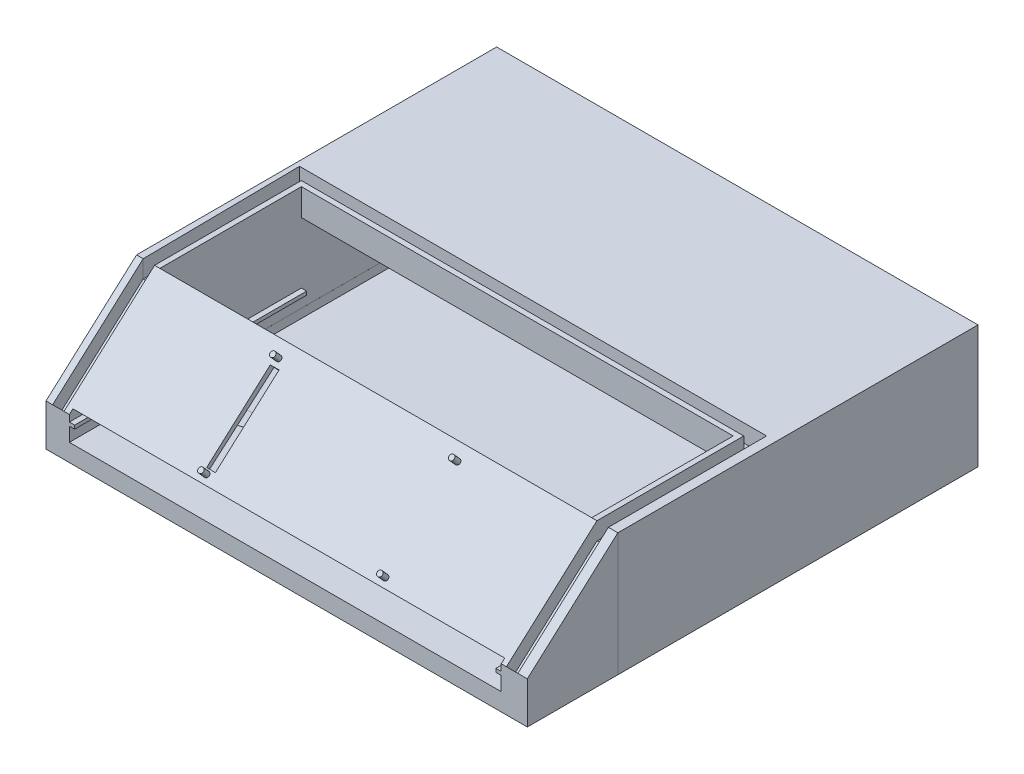
from build123d import *

# Parameters (mm, degrees)
BOSS_EXTRUDE1_DEPTH = 70
CUT_EXTRUDE1_DEPTH  = 10
SKETCH5_W           = 245.829798574
SKETCH5_H           = 84.902413675
CUT_EXTRUDE2_DEPTH  = 60
SKETCH6_R           = 11.15
CUT_EXTRUDE3_DEPTH  = 4.66
CUT_EXTRUDE4_DEPTH  = 5
SKETCH9_W           = 3
SKETCH9_H           = 2
BOSS_EXTRUDE3_DEPTH = 85
SKETCH11_W          = 245.829798574
SKETCH11_H          = 44.743760381
CUT_EXTRUDE6_DEPTH  = 109
BOSS_EXTRUDE5_DEPTH = 274
SKETCH20_W          = 6.5
SKETCH20_H          = 69.236704604
CUT_EXTRUDE7_DEPTH  = 7.45
CUT_EXTRUDE9_DEPTH  = 346.159891301
SKETCH23_W          = 6.5
SKETCH23_H          = 69.236704604
CUT_EXTRUDE10_DEPTH = 7.45
CUT_EXTRUDE11_START = -5.5
CUT_EXTRUDE11_DEPTH = 243
CUT_EXTRUDE12_DEPTH = 5
CUT_EXTRUDE13_DEPTH = 5
SKETCH32_R          = 1.5
BOSS_EXTRUDE7_DEPTH = 5
SKETCH35_W          = 5.00069672
SKETCH35_H          = 48.700830397
CUT_EXTRUDE14_DEPTH = 10
SKETCH38_R          = 1.575
BOSS_EXTRUDE8_DEPTH = 18


with BuildPart() as part:
    # Sketch1 → Boss-Extrude1 (new body)
    with BuildSketch(Plane(origin=(0, 0, 0), x_dir=(1, 0, 0), z_dir=(0, 1, 0))):
        Polygon((263, -90), (0, -90), (-5.297672508, -90), (-5.297672508, 115), (268.719836564, 115), (268.719836564, 109.817232955), (268.719836564, 5.622236561), (268.719836564, -90), align=None)
    extrude(amount=BOSS_EXTRUDE1_DEPTH)

    # Sketch4 → Cut-Extrude1 (cut)
    with BuildSketch(Plane(origin=(0, 70, 0), x_dir=(1, 0, 0), z_dir=(0, 1, 0))):
        Polygon((-1.518607935, -90.000001141), (4.981392065, -90), (4.981392065, -6.438755439), (256.811190639, -6.438755439), (256.811190639, -90), (263.311190639, -90), (263.311190639, 0.061244561), (-2.567831993, 0.061244561), align=None)
    extrude(amount=-CUT_EXTRUDE1_DEPTH, mode=Mode.SUBTRACT)

    # Sketch5 → Cut-Extrude2 (cut)
    with BuildSketch(Plane(origin=(0, 70, 0), x_dir=(1, 0, 0), z_dir=(0, 1, 0))):
        with Locations((130.896291352, -51.889962277)):
            Rectangle(SKETCH5_W, SKETCH5_H)
    extrude(amount=-CUT_EXTRUDE2_DEPTH, mode=Mode.SUBTRACT)

    # Sketch6 → Cut-Extrude3 (cut)
    with BuildSketch(Plane(origin=(0, 10, 0), x_dir=(1, 0, 0), z_dir=(0, 1, 0))):
        with Locations((131.857766281, -74.522104322)):
            Circle(SKETCH6_R)
        with Locations((45.409631344, -74.22492571)):
            Circle(SKETCH6_R)
        with Locations((217.983549657, -74.264123819)):
            Circle(SKETCH6_R)
    extrude(amount=-CUT_EXTRUDE3_DEPTH, mode=Mode.SUBTRACT)

    # Sketch7 → Cut-Extrude4 (cut)
    with BuildSketch(Plane(origin=(0, 10, 0), x_dir=(1, 0, 0), z_dir=(0, 1, 0))):
        Polygon((7.981392065, -70.253012436), (8, 98.962802173), (255.25, 98.962802173), (253.811190639, -70.717283821), align=None)
    extrude(amount=-CUT_EXTRUDE4_DEPTH, mode=Mode.SUBTRACT)

    # Sketch9 → Boss-Extrude3 (add)
    with BuildSketch(Plane.XY.offset(90)):
        with Locations((9.481392065, 19)):
            Rectangle(SKETCH9_W, SKETCH9_H)
    boss_extrude3 = extrude(amount=-BOSS_EXTRUDE3_DEPTH)

    # Mirror1: Boss-Extrude3 across plane
    add(boss_extrude3.mirror(Plane(origin=(130.896291352, 0, 0), x_dir=(0, 0, 1), z_dir=(1, 0, 0))))

    # Sketch11 → Cut-Extrude6 (cut)
    with BuildSketch(Plane.XY.offset(9.438755439)):
        with Locations((130.896291352, 32.371880191)):
            Rectangle(SKETCH11_W, SKETCH11_H)
    extrude(amount=-CUT_EXTRUDE6_DEPTH, mode=Mode.SUBTRACT)

    # Sketch19 → Boss-Extrude5 (add)
    with BuildSketch(Plane.ZY.offset(5.297672508)):
        Polygon((90, 70), (141.535887712, 23.763936779), (141.535887712, 0), (90, 0), align=None)
    extrude(amount=-BOSS_EXTRUDE5_DEPTH)

    # Sketch20 → Cut-Extrude7 (cut)
    with BuildSketch(Plane(origin=(0, 83.519631011, 74.93067668), x_dir=(1, 0, 0), z_dir=(0, 0.7443434520309503, 0.6677969941671259))):
        with Locations((260.061190639, -54.863473393)):
            Rectangle(SKETCH20_W, SKETCH20_H)
    extrude(amount=-CUT_EXTRUDE7_DEPTH, mode=Mode.SUBTRACT)

    # Sketch22 → Cut-Extrude9 (cut, through all)
    with BuildSketch(Plane(origin=(0, 0, 90), x_dir=(-1, 0, 0), z_dir=(0, 0, -1))):
        Polygon((-253.840928546, 22.97086858), (-253.840928546, 25.555278288), (-8.001338449, 25.555278288), (-8.001338449, 22.97086858), (-8.001338449, 19.995349822), (-11.001338449, 19.995349822), (-11.001338449, 17.978106602), (-8.001338449, 17.978106602), (-8.001338449, 10), (-253.840928546, 10), (-253.840928546, 18), (-250.840928546, 18), (-250.840928546, 20), (-253.840928546, 20), align=None)
    extrude(amount=-CUT_EXTRUDE9_DEPTH, mode=Mode.SUBTRACT)

    # Sketch23 → Cut-Extrude10 (cut)
    with BuildSketch(Plane(origin=(0, 83.519631011, 74.93067668), x_dir=(1, 0, 0), z_dir=(0, 0.7443434520309503, 0.667796994167126))):
        with Locations((1.731392065, -54.863473393)):
            Rectangle(SKETCH23_W, SKETCH23_H)
    extrude(amount=-CUT_EXTRUDE10_DEPTH, mode=Mode.SUBTRACT)

    # Sketch26 → Cut-Extrude11 (cut)
    with BuildSketch(Plane.ZY.offset(-4.981392065).offset(CUT_EXTRUDE11_START)):
        Polygon((88.641700654, 66.783619732), (134.470436586, 26.948873274), (134.470436586, 21.410807665), (88.641700654, 21.3490784), align=None)
    extrude(amount=-CUT_EXTRUDE11_DEPTH, mode=Mode.SUBTRACT)

    # Sketch30 → Cut-Extrude12 (cut)
    with BuildSketch(Plane(origin=(0, 10, 0), x_dir=(1, 0, 0), z_dir=(0, 1, 0))):
        Polygon((88.314745977, -77.905708578), (84.07588093, -77.905708578), (84.07588093, -74.335398656), (84.57588093, -74.335398656), (84.57588093, -69.534898582), (87.804476446, -69.534898582), (87.804476446, -74.335398656), (88.314745977, -74.335398656), align=None)
    extrude(amount=-CUT_EXTRUDE12_DEPTH, mode=Mode.SUBTRACT)

    # Sketch31 → Cut-Extrude13 (cut)
    with BuildSketch(Plane(origin=(0, 10, 0), x_dir=(1, 0, 0), z_dir=(0, 1, 0))):
        Polygon((179.452231856, -78.850570011), (175.213366808, -78.850570011), (175.213366808, -75.280260088), (175.713366808, -75.280260088), (175.713366808, -70.479760014), (178.941962324, -70.479760014), (178.941962324, -75.280260088), (179.452231856, -75.280260088), align=None)
    extrude(amount=-CUT_EXTRUDE13_DEPTH, mode=Mode.SUBTRACT)

    # Sketch32 → Boss-Extrude7 (add)
    with BuildSketch(Plane(origin=(0, 83.519631011, 74.93067668), x_dir=(1, 0, 0), z_dir=(0, 0.7443434520309503, 0.667796994167126))):
        with Locations((81.180008505, -27.716796443)):
            Circle(SKETCH32_R)
        with Locations((81.180008505, -82.709942193)):
            Circle(SKETCH32_R)
        with Locations((183.023154256, -82.709942193)):
            Circle(SKETCH32_R)
        with Locations((183.023154256, -27.716796443)):
            Circle(SKETCH32_R)
    extrude(amount=BOSS_EXTRUDE7_DEPTH)

    # Sketch35 → Cut-Extrude14 (cut)
    with BuildSketch(Plane(origin=(0, 83.519631011, 74.93067668), x_dir=(1, 0, 0), z_dir=(0, 0.7443434520309503, 0.667796994167126))):
        with Locations((81.856485767, -56.021290861)):
            Rectangle(SKETCH35_W, SKETCH35_H)
    extrude(amount=-CUT_EXTRUDE14_DEPTH, mode=Mode.SUBTRACT)

    # Sketch38 → Boss-Extrude8 (add)
    with BuildSketch(Plane.XY.offset(-99.561244561)):
        with Locations((10.341559759, 12.837320316)):
            Circle(SKETCH38_R)
        with Locations((10.341559759, 50.187320316)):
            Circle(SKETCH38_R)
        with Locations((93.541559759, 12.837320316)):
            Circle(SKETCH38_R)
        with Locations((93.541559759, 50.187320316)):
            Circle(SKETCH38_R)
    extrude(amount=BOSS_EXTRUDE8_DEPTH)


solid = part.part
